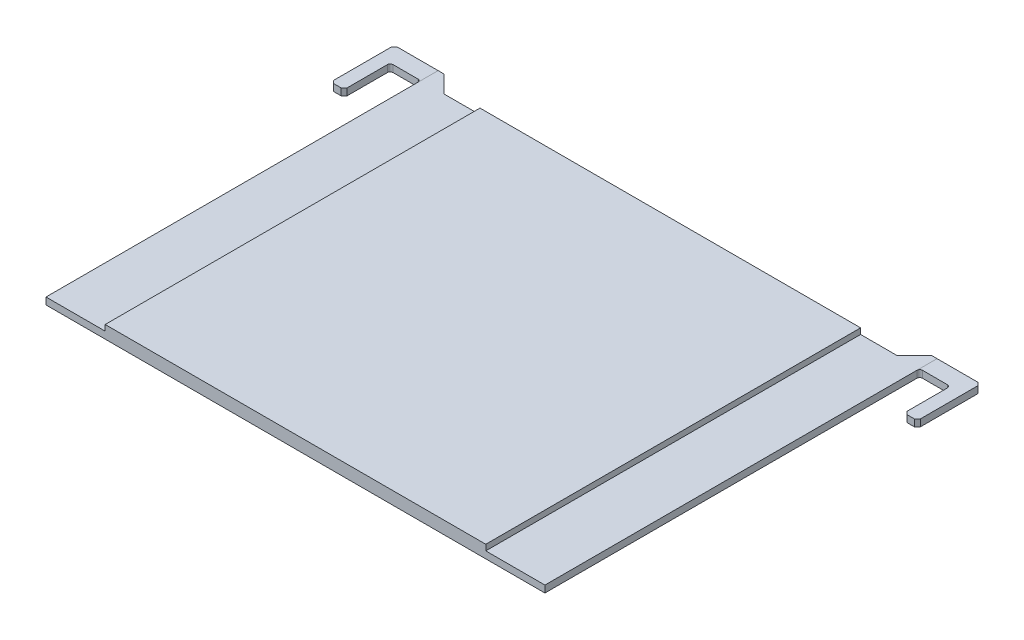
from build123d import *

# Parameters (mm, degrees)
SKETCH1_W                = 86.52
SKETCH1_H                = 65
BOSS_EXTRUDE1_DEPTH      = 1.2
SKETCH2_W                = 66
SKETCH2_H                = 1
BOSS_EXTRUDE2_DEPTH      = 65
BOSS_EXTRUDE5_DEPTH      = 3
BOSS_EXTRUDE5_DEPTH_BACK = 0.01
CHAMFER1_SIZE            = 2
CHAMFER2_SIZE            = 2
CHAMFER3_SIZE            = 1
SKETCH5_W                = 2.3
SKETCH5_H                = 1.199074312
BOSS_EXTRUDE7_DEPTH      = 8
CHAMFER5_SIZE            = 0.5
FILLET3_R                = 0.5


with BuildPart() as part:
    # Sketch1 → Boss-Extrude1 (new body)
    with BuildSketch(Plane(origin=(0, 0, 0), x_dir=(1, 0, 0), z_dir=(0, 1, 0))):
        Rectangle(SKETCH1_W, SKETCH1_H)
    extrude(amount=BOSS_EXTRUDE1_DEPTH)

    # Sketch2 → Boss-Extrude2 (add)
    with BuildSketch(Plane.XY.offset(32.5)):
        with Locations((0, 1.7)):
            Rectangle(SKETCH2_W, SKETCH2_H)
    extrude(amount=-BOSS_EXTRUDE2_DEPTH)

    # Sketch3 → Boss-Extrude5 (add, two sides: drawn at the far end of the back side and taken through both)
    with BuildSketch(Plane(origin=(0, 0, -32.5), x_dir=(-1, 0, 0), z_dir=(0, 0, -1)).offset(-BOSS_EXTRUDE5_DEPTH_BACK)):
        Polygon((-43.26, 1.2), (-43.26, 1.199074312), (-50.859139548, 1.199074312), (-50.859139548, 0), (-40.26, 0), (-40.26, 1.2), align=None)
        Polygon((40.26, 1.2), (40.26, 0), (50.859139548, 0), (50.859139548, 1.199074312), (43.26, 1.199074312), (43.26, 1.2), align=None)
    extrude(amount=BOSS_EXTRUDE5_DEPTH + BOSS_EXTRUDE5_DEPTH_BACK)

    # Chamfer1
    chamfer1_edges = [part.edges().sort_by_distance(p)[0] for p in [
        (40.26, 0.6, -35.5),
    ]]
    chamfer(chamfer1_edges, length=CHAMFER1_SIZE)

    # Chamfer2
    chamfer2_edges = [part.edges().sort_by_distance(p)[0] for p in [
        (-40.26, 0.6, -35.5),
    ]]
    chamfer(chamfer2_edges, length=CHAMFER2_SIZE)

    # Chamfer3
    chamfer3_edges = [part.edges().sort_by_distance(p)[0] for p in [
        (-40.26, 0.6, -32.5),
        (40.26, 0.6, -32.5),
    ]]
    chamfer(chamfer3_edges, length=CHAMFER3_SIZE - 0.0001)  # a hair under: the kernel refuses the full size

    # Sketch5 → Boss-Extrude7 (add)
    with BuildSketch(Plane.XY.offset(-32.49)):
        with Locations((-49.709139548, 0.599537156)):
            Rectangle(SKETCH5_W, SKETCH5_H)
        with Locations((49.709139548, 0.599537156)):
            Rectangle(SKETCH5_W, SKETCH5_H)
    extrude(amount=BOSS_EXTRUDE7_DEPTH)

    # Chamfer5
    chamfer5_edges = [part.edges().sort_by_distance(p)[0] for p in [
        (-48.559139548, 0.599537156, -24.49),
        (-50.859139548, 0.599537156, -24.49),
        (50.859139548, 0.599537156, -24.49),
        (48.559139548, 0.599537156, -24.49),
        (-50.859139548, 0.599537156, -35.5),
        (50.859139548, 0.599537156, -35.5),
    ]]
    chamfer(chamfer5_edges, length=CHAMFER5_SIZE)

    # Fillet3
    fillet3_edges = [part.edges().sort_by_distance(p)[0] for p in [
        (-48.559139548, 0.599537156, -32.49),
        (48.559139548, 0.599537156, -32.49),
        (-43.26, 0.599537156, -32.49),
        (43.26, 0.599537156, -32.49),
    ]]
    fillet(fillet3_edges, radius=FILLET3_R)


solid = part.part
